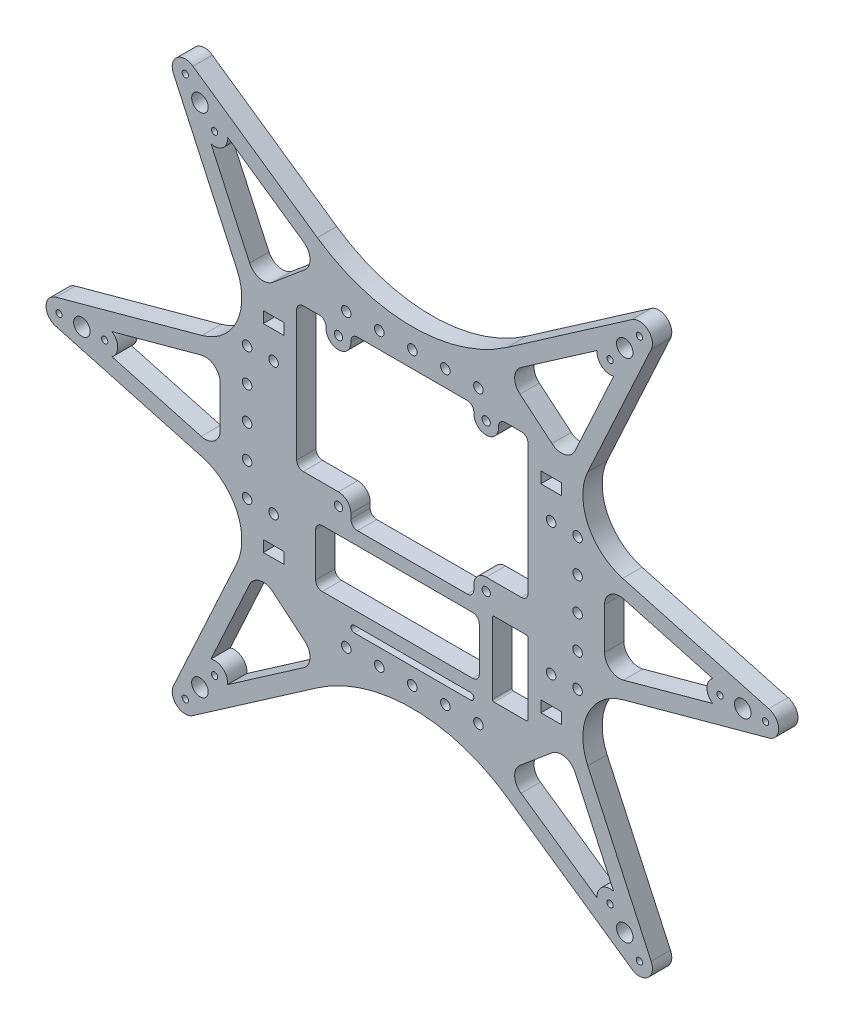
from build123d import *

# Parameters (mm, degrees)
SKETCH1_R             = 0.95
SKETCH1_R_2           = 1.45
SKETCH1_R_3           = 2.5
SKETCH1_R_4           = 1.449999999
SKETCH1_W             = 70
SKETCH1_H             = 78
SKETCH1_W_2           = 6.2
SKETCH1_H_2           = 3.4
BOSS_EXTRUDE1_DEPTH   = 5.85
SKETCH2_R             = 1.25
BOSS_EXTRUDE3_DEPTH   = 5.85
BOSS_EXTRUDE3_2_DEPTH = 5.85
SKETCH2_W             = 49.5
SKETCH2_H             = 17.27
BOSS_EXTRUDE3_3_DEPTH = 5.85
FILLET2_R             = 2
FILLET3_R             = 2
FILLET4_R             = 0.5
FILLET5_R             = 1
FILLET6_R             = 2


with BuildPart() as part:
    # Sketch1 → Boss-Extrude1 (new body)
    with BuildSketch(Plane.XY):
        with BuildLine():
            Line((587.176754813, 489.096238418), (568.014947547, 530.703594601))
            ThreePointArc((568.014947547, 530.703594601), (569.023643468, 535.466212845), (573.889065048, 535.63256443))
            Line((573.889065048, 535.63256443), (611.536899087, 509.536826494))
            ThreePointArc((611.536899087, 509.536826494), (640.276650002, 500.550186325), (669.016400917, 509.536826494))
            Line((669.016400917, 509.536826494), (706.664234956, 535.63256443))
            ThreePointArc((706.664234956, 535.63256443), (711.529656536, 535.466212845), (712.538352458, 530.703594601))
            Line((712.538352458, 530.703594601), (693.376545192, 489.096238418))
            ThreePointArc((693.376545192, 489.096238418), (693.409240928, 475.326320371), (703.936593716, 466.450141278))
            Line((703.936593716, 466.450141278), (748.126650002, 454.384244227))
            ThreePointArc((748.126650002, 454.384244227), (751.126650002, 450.550186325), (748.126650002, 446.716128422))
            Line((748.126650002, 446.716128422), (703.936593716, 434.650231372))
            ThreePointArc((703.936593716, 434.650231372), (693.409240928, 425.774052279), (693.376545192, 412.004134232))
            Line((693.376545192, 412.004134232), (712.538352458, 370.396778049))
            ThreePointArc((712.538352458, 370.396778049), (711.529656536, 365.634159805), (706.664234956, 365.46780822))
            Line((706.664234956, 365.46780822), (669.016400917, 391.563546156))
            ThreePointArc((669.016400917, 391.563546156), (640.276650002, 400.550186325), (611.536899087, 391.563546156))
            Line((611.536899087, 391.563546156), (573.889065048, 365.46780822))
            ThreePointArc((573.889065048, 365.46780822), (569.023643468, 365.634159805), (568.014947547, 370.396778049))
            Line((568.014947547, 370.396778049), (587.176754813, 412.004134232))
            ThreePointArc((587.176754813, 412.004134232), (587.144059076, 425.774052279), (576.616706289, 434.650231372))
            Line((576.616706289, 434.650231372), (532.426650002, 446.716128422))
            ThreePointArc((532.426650002, 446.716128422), (529.426650002, 450.550186325), (532.426650002, 454.384244227))
            Line((532.426650002, 454.384244227), (576.616706289, 466.450141278))
            ThreePointArc((576.616706289, 466.450141278), (587.144059076, 475.326320371), (587.176754813, 489.096238418))
        make_face()
        with Locations((533.376650002, 450.550186325)):
            Circle(SKETCH1_R, mode=Mode.SUBTRACT)
        with Locations(Location((598.276650002, 430.550186325, 0), (0, 0, 180))):
            Circle(SKETCH1_R_2, mode=Mode.SUBTRACT)
        with Locations((575.997889034, 527.154630637)):
            Circle(SKETCH1_R_3, mode=Mode.SUBTRACT)
        with Locations((547.176650002, 450.550186325)):
            Circle(SKETCH1_R, mode=Mode.SUBTRACT)
        with Locations((540.276650002, 450.550186325)):
            Circle(SKETCH1_R_3, mode=Mode.SUBTRACT)
        with Locations((590.276650002, 460.550186325)):
            Circle(SKETCH1_R_4, mode=Mode.SUBTRACT)
        with Locations((571.562654527, 532.440337294)):
            Circle(SKETCH1_R, mode=Mode.SUBTRACT)
        with Locations((580.43312354, 521.868923979)):
            Circle(SKETCH1_R, mode=Mode.SUBTRACT)
        with Locations((690.276650002, 440.550186325)):
            Circle(SKETCH1_R_4, mode=Mode.SUBTRACT)
        with Locations(Location((682.276650002, 470.550186325, 0), (0, 0, 180))):
            Circle(SKETCH1_R_2, mode=Mode.SUBTRACT)
        with Locations(Location((640.276650002, 406.550186325, 0), (0, 0, 180))):
            Circle(SKETCH1_R_2, mode=Mode.SUBTRACT)
        with Locations((690.276650002, 430.550186325)):
            Circle(SKETCH1_R_4, mode=Mode.SUBTRACT)
        with Locations((704.555410971, 373.945742013)):
            Circle(SKETCH1_R_3, mode=Mode.SUBTRACT)
        with Locations((708.990645478, 368.660035356)):
            Circle(SKETCH1_R, mode=Mode.SUBTRACT)
        with Locations((700.120176464, 379.231448671)):
            Circle(SKETCH1_R, mode=Mode.SUBTRACT)
        with Locations((630.276650002, 494.550186325)):
            Circle(SKETCH1_R_2, mode=Mode.SUBTRACT)
        with Locations((620.276650002, 494.550186325)):
            Circle(SKETCH1_R_2, mode=Mode.SUBTRACT)
        with Locations((650.276650002, 406.550186325)):
            Circle(SKETCH1_R_2, mode=Mode.SUBTRACT)
        with Locations((660.276650002, 406.550186325)):
            Circle(SKETCH1_R_2, mode=Mode.SUBTRACT)
        with Locations(Location((590.276650002, 430.550186325, 0), (0, 0, 180))):
            Circle(SKETCH1_R_4, mode=Mode.SUBTRACT)
        with Locations(Location((620.276650002, 406.550186325, 0), (0, 0, 180))):
            Circle(SKETCH1_R_2, mode=Mode.SUBTRACT)
        with Locations(Location((630.276650002, 406.550186325, 0), (0, 0, 180))):
            Circle(SKETCH1_R_2, mode=Mode.SUBTRACT)
        with Locations((682.276650002, 430.550186325)):
            Circle(SKETCH1_R_2, mode=Mode.SUBTRACT)
        with Locations((590.276650002, 470.550186325)):
            Circle(SKETCH1_R_4, mode=Mode.SUBTRACT)
        with Locations(Location((580.43312354, 379.231448671, 0), (0, 0, 180))):
            Circle(SKETCH1_R, mode=Mode.SUBTRACT)
        with Locations(Location((571.562654527, 368.660035356, 0), (0, 0, 180))):
            Circle(SKETCH1_R, mode=Mode.SUBTRACT)
        with Locations(Location((590.276650002, 440.550186325, 0), (0, 0, 180))):
            Circle(SKETCH1_R_4, mode=Mode.SUBTRACT)
        with Locations(Location((575.997889034, 373.945742013, 0), (0, 0, 180))):
            Circle(SKETCH1_R_3, mode=Mode.SUBTRACT)
        with Locations(Location((660.276650002, 494.550186325, 0), (0, 0, 180))):
            Circle(SKETCH1_R_2, mode=Mode.SUBTRACT)
        with Locations(Location((650.276650002, 494.550186325, 0), (0, 0, 180))):
            Circle(SKETCH1_R_2, mode=Mode.SUBTRACT)
        with Locations(Location((700.120176464, 521.868923979, 0), (0, 0, 180))):
            Circle(SKETCH1_R, mode=Mode.SUBTRACT)
        with Locations(Location((708.990645478, 532.440337294, 0), (0, 0, 180))):
            Circle(SKETCH1_R, mode=Mode.SUBTRACT)
        with Locations(Location((690.276650002, 450.550186325, 0), (0, 0, 180))):
            Circle(SKETCH1_R_4, mode=Mode.SUBTRACT)
        with Locations(Location((740.276650002, 450.550186325, 0), (0, 0, 180))):
            Circle(SKETCH1_R_3, mode=Mode.SUBTRACT)
        with Locations(Location((733.376650002, 450.550186325, 0), (0, 0, 180))):
            Circle(SKETCH1_R, mode=Mode.SUBTRACT)
        with Locations(Location((704.555410971, 527.154630637, 0), (0, 0, 180))):
            Circle(SKETCH1_R_3, mode=Mode.SUBTRACT)
        with Locations(Location((747.176650002, 450.550186325, 0), (0, 0, 180))):
            Circle(SKETCH1_R, mode=Mode.SUBTRACT)
        with Locations(Location((690.276650002, 470.550186325, 0), (0, 0, 180))):
            Circle(SKETCH1_R_4, mode=Mode.SUBTRACT)
        with Locations((640.276650002, 494.550186325)):
            Circle(SKETCH1_R_2, mode=Mode.SUBTRACT)
        with Locations(Location((690.276650002, 460.550186325, 0), (0, 0, 180))):
            Circle(SKETCH1_R_4, mode=Mode.SUBTRACT)
        with Locations((590.276650002, 450.550186325)):
            Circle(SKETCH1_R_4, mode=Mode.SUBTRACT)
        with Locations((598.276650002, 470.550186325)):
            Circle(SKETCH1_R_2, mode=Mode.SUBTRACT)
        with BuildLine():
            Line((549.378217697, 453.82975942), (576.389421361, 461.205047663))
            ThreePointArc((576.389421361, 461.205047663), (580.337323048, 460.434368256), (582.12067631, 456.828882764))
            Line((582.12067631, 456.828882764), (582.12067631, 444.271489885))
            ThreePointArc((582.12067631, 444.271489885), (580.337323048, 440.666004394), (576.389421361, 439.895324987))
            Line((576.389421361, 439.895324987), (549.378217697, 447.27061323))
            ThreePointArc((549.378217697, 447.27061323), (551.126650002, 450.550186325), (549.378217697, 453.82975942))
        make_face(mode=Mode.SUBTRACT)
        with Locations((640.276650002, 450.550186325)):
            Rectangle(SKETCH1_W, SKETCH1_H, mode=Mode.SUBTRACT)
        with Locations((598.276650002, 420.550186325)):
            Rectangle(SKETCH1_W_2, SKETCH1_H_2, mode=Mode.SUBTRACT)
        with BuildLine():
            Line((731.175082307, 447.27061323), (704.163878644, 439.895324987))
            ThreePointArc((704.163878644, 439.895324987), (700.215976956, 440.666004394), (698.432623695, 444.271489885))
            Line((698.432623695, 444.271489885), (698.432623695, 456.828882764))
            ThreePointArc((698.432623695, 456.828882764), (700.215976956, 460.434368256), (704.163878644, 461.205047663))
            Line((704.163878644, 461.205047663), (731.175082307, 453.82975942))
            ThreePointArc((731.175082307, 453.82975942), (729.426650002, 450.550186325), (731.175082307, 447.27061323))
        make_face(mode=Mode.SUBTRACT)
        with Locations((682.276650002, 420.550186325)):
            Rectangle(SKETCH1_W_2, SKETCH1_H_2, mode=Mode.SUBTRACT)
        with BuildLine():
            Line((701.217334773, 383.02601632), (689.50466631, 408.458542689))
            ThreePointArc((689.50466631, 408.458542689), (686.402651889, 410.966389543), (682.526885868, 410.022871097))
            Line((682.526885868, 410.022871097), (672.851587783, 401.904332043))
            ThreePointArc((672.851587783, 401.904332043), (671.249383797, 398.251287875), (673.18047167, 394.760916987))
            Line((673.18047167, 394.760916987), (696.192737283, 378.809878419))
            ThreePointArc((696.192737283, 378.809878419), (697.581165406, 382.257324221), (701.217334773, 383.02601632))
        make_face(mode=Mode.SUBTRACT)
        with BuildLine():
            Line((607.701712221, 401.904332043), (598.026414137, 410.022871097))
            ThreePointArc((598.026414137, 410.022871097), (594.150648115, 410.966389543), (591.048633694, 408.458542689))
            Line((591.048633694, 408.458542689), (579.335965232, 383.02601632))
            ThreePointArc((579.335965232, 383.02601632), (582.972134599, 382.257324221), (584.360562722, 378.809878419))
            Line((584.360562722, 378.809878419), (607.372828334, 394.760916987))
            ThreePointArc((607.372828334, 394.760916987), (609.303916208, 398.251287875), (607.701712221, 401.904332043))
        make_face(mode=Mode.SUBTRACT)
        with BuildLine():
            Line((579.335965232, 518.07435633), (591.048633694, 492.641829961))
            ThreePointArc((591.048633694, 492.641829961), (594.150648115, 490.133983107), (598.026414137, 491.077501553))
            Line((598.026414137, 491.077501553), (607.701712221, 499.196040607))
            ThreePointArc((607.701712221, 499.196040607), (609.303916208, 502.849084775), (607.372828334, 506.339455663))
            Line((607.372828334, 506.339455663), (584.360562722, 522.29049423))
            ThreePointArc((584.360562722, 522.29049423), (582.972134599, 518.843048429), (579.335965232, 518.07435633))
        make_face(mode=Mode.SUBTRACT)
        with Locations((682.276650002, 480.550186325)):
            Rectangle(SKETCH1_W_2, SKETCH1_H_2, mode=Mode.SUBTRACT)
        with BuildLine():
            Line((672.851587783, 499.196040607), (682.526885868, 491.077501553))
            ThreePointArc((682.526885868, 491.077501553), (686.402651889, 490.133983107), (689.50466631, 492.641829961))
            Line((689.50466631, 492.641829961), (701.217334773, 518.07435633))
            ThreePointArc((701.217334773, 518.07435633), (697.581165406, 518.843048429), (696.192737283, 522.29049423))
            Line((696.192737283, 522.29049423), (673.18047167, 506.339455663))
            ThreePointArc((673.18047167, 506.339455663), (671.249383797, 502.849084775), (672.851587783, 499.196040607))
        make_face(mode=Mode.SUBTRACT)
        with Locations((598.276650002, 480.550186325)):
            Rectangle(SKETCH1_W_2, SKETCH1_H_2, mode=Mode.SUBTRACT)
    extrude(amount=BOSS_EXTRUDE1_DEPTH)


with BuildPart() as body_2:
    # Sketch2 → Boss-Extrude3 (new body)
    with BuildSketch(Plane.XY.offset(5.85)):
        with BuildLine():
            Line((621.671650002, 487.080186325), (621.671650002, 489.550186325))
            Line((621.671650002, 489.550186325), (614.171650002, 489.550186325))
            Line((614.171650002, 489.550186325), (614.171650002, 487.080186325))
            ThreePointArc((614.171650002, 487.080186325), (617.921650002, 483.330186325), (621.671650002, 487.080186325))
        make_face()
        with Locations((617.921650002, 487.080186325)):
            Circle(SKETCH2_R, mode=Mode.SUBTRACT)
    extrude(amount=-BOSS_EXTRUDE3_DEPTH)


with BuildPart() as body_3:
    # Sketch2 → Boss-Extrude3 2 (new body)
    with BuildSketch(Plane.XY.offset(5.85)):
        with BuildLine():
            Line((666.381650002, 487.080186325), (666.381650002, 489.550186325))
            Line((666.381650002, 489.550186325), (658.881650002, 489.550186325))
            Line((658.881650002, 489.550186325), (658.881650002, 487.080186325))
            ThreePointArc((658.881650002, 487.080186325), (662.631650002, 483.330186325), (666.381650002, 487.080186325))
        make_face()
        with Locations((662.631650002, 487.080186325)):
            Circle(SKETCH2_R, mode=Mode.SUBTRACT)
    extrude(amount=-BOSS_EXTRUDE3_2_DEPTH)


with BuildPart() as body_4:
    # Sketch2 → Boss-Extrude3 3 (new body)
    with BuildSketch(Plane.XY.offset(5.85)):
        with BuildLine():
            Line((675.276650002, 437.050186325), (675.276650002, 446.120186325))
            Line((675.276650002, 446.120186325), (662.631650002, 446.120186325))
            ThreePointArc((662.631650002, 446.120186325), (659.979999573, 445.021836754), (658.881650002, 442.370186325))
            Line((658.881650002, 442.370186325), (658.881650002, 438.820186325))
            Line((658.881650002, 438.820186325), (621.671650002, 438.820186325))
            Line((621.671650002, 438.820186325), (621.671650002, 442.370186325))
            ThreePointArc((621.671650002, 442.370186325), (620.573300432, 445.021836754), (617.921650002, 446.120186325))
            Line((617.921650002, 446.120186325), (605.276650002, 446.120186325))
            Line((605.276650002, 446.120186325), (605.276650002, 411.550186325))
            Line((605.276650002, 411.550186325), (621.671650002, 411.550186325))
            Line((621.671650002, 411.550186325), (621.671650002, 413.550186325))
            Line((621.671650002, 413.550186325), (658.881650002, 413.550186325))
            Line((658.881650002, 413.550186325), (658.881650002, 411.550186325))
            Line((658.881650002, 411.550186325), (675.276650002, 411.550186325))
            Line((675.276650002, 411.550186325), (675.276650002, 414.550186325))
            Line((675.276650002, 414.550186325), (664.526650002, 414.550186325))
            Line((664.526650002, 414.550186325), (664.526650002, 437.050186325))
            Line((664.526650002, 437.050186325), (675.276650002, 437.050186325))
        make_face()
        with Locations((635.776650002, 426.185186325)):
            Rectangle(SKETCH2_W, SKETCH2_H, mode=Mode.SUBTRACT)
        with Locations((617.921650002, 442.370186325)):
            Circle(SKETCH2_R, mode=Mode.SUBTRACT)
        with Locations((662.631650002, 442.370186325)):
            Circle(SKETCH2_R, mode=Mode.SUBTRACT)
    extrude(amount=-BOSS_EXTRUDE3_3_DEPTH)


with BuildPart() as body_2_1:
    add(body_2.part)

    # Combine1: union body 3, body 4, part
    add(body_3.part)
    add(body_4.part)
    add(part.part)

    # Fillet2
    fillet2_edges = [body_2_1.edges().sort_by_distance(p)[0] for p in [
        (621.671650002, 438.820186325, 2.925),
    ]]
    fillet(fillet2_edges, radius=FILLET2_R)

    # Fillet3
    fillet3_edges = [body_2_1.edges().sort_by_distance(p)[0] for p in [
        (614.171650002, 489.550186325, 2.925),
        (621.671650002, 489.550186325, 2.925),
        (666.381650002, 489.550186325, 2.925),
        (658.881650002, 489.550186325, 2.925),
        (658.881650002, 438.820186325, 2.925),
        (611.026650002, 434.820186325, 2.925),
        (660.526650002, 434.820186325, 2.925),
        (660.526650002, 417.550186325, 2.925),
        (611.026650002, 417.550186325, 2.925),
    ]]
    fillet(fillet3_edges, radius=FILLET3_R)

    # Fillet4
    fillet4_edges = [body_2_1.edges().sort_by_distance(p)[0] for p in [
        (664.526650002, 414.550186325, 2.925),
        (664.526650002, 437.050186325, 2.925),
        (675.276650002, 437.050186325, 2.925),
        (675.276650002, 414.550186325, 2.925),
    ]]
    fillet(fillet4_edges, radius=FILLET4_R)

    # Fillet5
    fillet5_edges = [body_2_1.edges().sort_by_distance(p)[0] for p in [
        (658.881650002, 411.550186325, 2.925),
        (658.881650002, 413.550186325, 2.925),
        (621.671650002, 411.550186325, 2.925),
        (621.671650002, 413.550186325, 2.925),
    ]]
    fillet(fillet5_edges, radius=FILLET5_R - 0.0001)  # a hair under: the kernel refuses the full size

    # Fillet6
    fillet6_edges = [body_2_1.edges().sort_by_distance(p)[0] for p in [
        (605.276650002, 489.550186325, 2.925),
        (605.276650002, 446.120186325, 2.925),
        (675.276650002, 446.120186325, 2.925),
        (675.276650002, 489.550186325, 2.925),
    ]]
    fillet(fillet6_edges, radius=FILLET6_R)


solid = body_2_1.part
